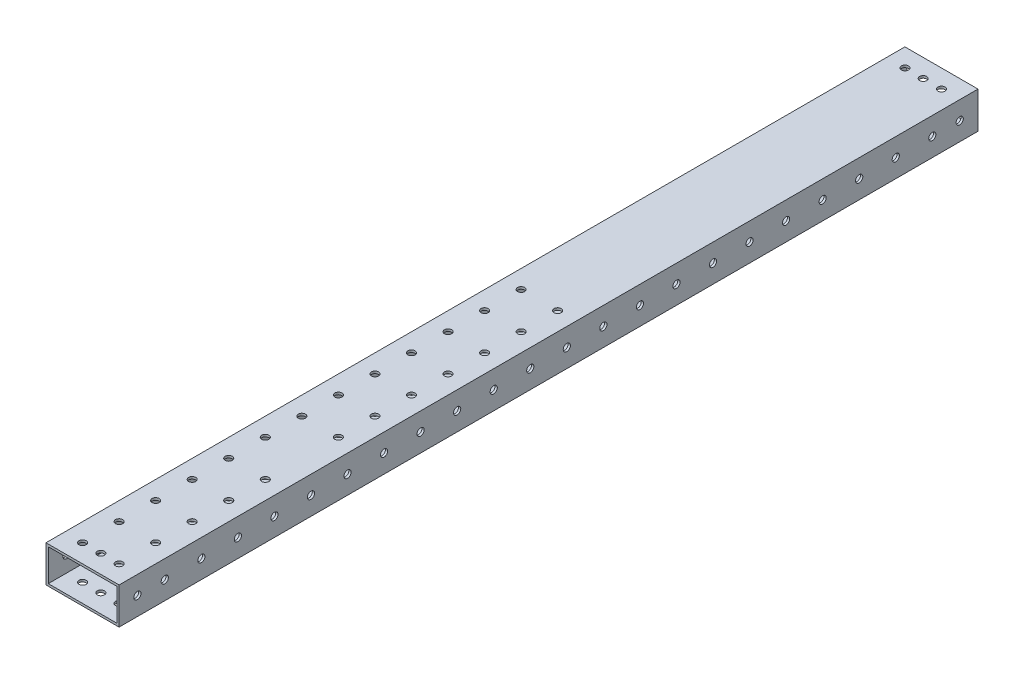
from build123d import *

# Parameters (mm, degrees)
SKETCH1_W           = 50.8
SKETCH1_H           = 25.4
BOSS_EXTRUDE1_DEPTH = 298.45
SHELL1_T            = -1.5875
SKETCH2_R           = 2.4892
CUT_EXTRUDE1_DEPTH  = 304.806192333
SKETCH3_R           = 2.4892
CUT_EXTRUDE2_DEPTH  = 304.806192333
SKETCH4_R           = 2.4892
CUT_EXTRUDE3_DEPTH  = 304.806192333
LPATTERN1_COUNT     = 22
LPATTERN1_PITCH     = 25.4
SKETCH5_R           = 2.4892
CUT_EXTRUDE4_DEPTH  = 304.806192333


with BuildPart() as part:
    # Sketch1 → Boss-Extrude1 (new, symmetric)
    with BuildSketch(Plane.XY):
        with Locations((25.4, 12.7)):
            Rectangle(SKETCH1_W, SKETCH1_H)
    extrude(amount=BOSS_EXTRUDE1_DEPTH, both=True)

    # Shell1
    shell1_openings = [part.faces().sort_by_distance(p)[0] for p in [
        (25.4, 12.7, -298.45),
        (25.4, 12.7, 298.45),
    ]]
    offset(amount=SHELL1_T, openings=shell1_openings, kind=Kind.INTERSECTION)

    # Sketch2 → Cut-Extrude1 (cut, through all)
    with BuildSketch(Plane(origin=(0, 25.4, 0), x_dir=(1, 0, 0), z_dir=(0, 1, 0))):
        with Locations((38.1, -285.75)):
            Circle(SKETCH2_R)
        with Locations((25.4, -285.75)):
            Circle(SKETCH2_R)
        with Locations((12.7, -285.75)):
            Circle(SKETCH2_R)
    cut_extrude1 = extrude(amount=-CUT_EXTRUDE1_DEPTH, mode=Mode.SUBTRACT)

    # Sketch3 → Cut-Extrude2 (cut, through all)
    with BuildSketch(Plane(origin=(50.8, 0, 0), x_dir=(0, 0, -1), z_dir=(1, 0, 0))):
        with Locations((-285.75, 12.7)):
            Circle(SKETCH3_R)
    cut_extrude2 = extrude(amount=-CUT_EXTRUDE2_DEPTH, mode=Mode.SUBTRACT)

    # Mirror1: Cut-Extrude1, Cut-Extrude2 across plane
    add(cut_extrude1.mirror(Plane.XY), mode=Mode.SUBTRACT)
    add(cut_extrude2.mirror(Plane.XY), mode=Mode.SUBTRACT)

    # Sketch4 → Cut-Extrude3 (cut, symmetric)
    with BuildSketch(Plane(origin=(50.8, 0, 0), x_dir=(0, 0, -1), z_dir=(1, 0, 0))):
        with Locations((-266.7, 12.7)):
            Circle(SKETCH4_R)
    cut_extrude3 = extrude(amount=CUT_EXTRUDE3_DEPTH, both=True, mode=Mode.SUBTRACT)

    # LPattern1: Cut-Extrude3 ×22
    with Locations(*[(0, 0, -i * LPATTERN1_PITCH) for i in range(1, LPATTERN1_COUNT)]):
        add(cut_extrude3, mode=Mode.SUBTRACT)

    # Sketch5 → Cut-Extrude4 (cut, through all)
    with BuildSketch(Plane.XZ):
        with Locations((12.7, 158.75)):
            Circle(SKETCH5_R)
        with Locations((12.7, 184.15)):
            Circle(SKETCH5_R)
        with Locations((38.1, 184.15)):
            Circle(SKETCH5_R)
        with Locations((38.1, 209.55)):
            Circle(SKETCH5_R)
        with Locations((12.7, 209.55)):
            Circle(SKETCH5_R)
        with Locations((12.7, 234.95)):
            Circle(SKETCH5_R)
        with Locations((38.1, 234.95)):
            Circle(SKETCH5_R)
        with Locations((38.1, 260.35)):
            Circle(SKETCH5_R)
        with Locations((12.7, 260.35)):
            Circle(SKETCH5_R)
        with Locations((12.7, 31.75)):
            Circle(SKETCH5_R)
        with Locations((38.1, 31.75)):
            Circle(SKETCH5_R)
        with Locations((12.7, 57.15)):
            Circle(SKETCH5_R)
        with Locations((38.1, 57.15)):
            Circle(SKETCH5_R)
        with Locations((12.7, 82.55)):
            Circle(SKETCH5_R)
        with Locations((38.1, 82.55)):
            Circle(SKETCH5_R)
        with Locations((38.1, 107.95)):
            Circle(SKETCH5_R)
        with Locations((38.1, 133.35)):
            Circle(SKETCH5_R)
        with Locations((12.7, 107.95)):
            Circle(SKETCH5_R)
        with Locations((12.7, 133.35)):
            Circle(SKETCH5_R)
        with Locations((38.1, 6.35)):
            Circle(SKETCH5_R)
        with Locations((38.1, -19.05)):
            Circle(SKETCH5_R)
        with Locations((12.7, -19.05)):
            Circle(SKETCH5_R)
        with Locations((12.7, 6.35)):
            Circle(SKETCH5_R)
    extrude(amount=-CUT_EXTRUDE4_DEPTH, mode=Mode.SUBTRACT)


solid = part.part
